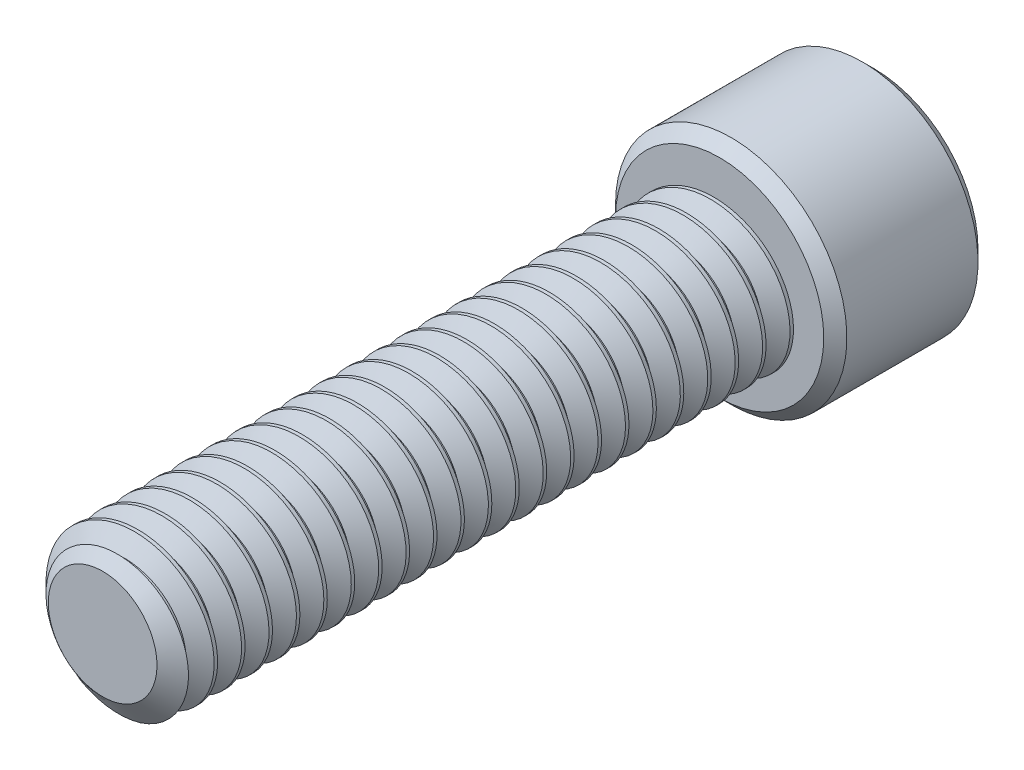
from build123d import *

# Parameters (mm, degrees)
SKETCH1_R          = 3.96875
EXTRUDE1_DEPTH     = 31.75
CUT_SWEEP1_PITCH   = 1.411111111
SKETCH6_R          = 5.953125
EXTRUDE2_DEPTH     = 7.9375
CUT_EXTRUDE1_DEPTH = 4.7625
CHAMFER1_SIZE      = 0.5953125


with BuildPart() as part:
    # Sketch1 → Extrude1 (new body)
    with BuildSketch(Plane.XY):
        Circle(SKETCH1_R)
    extrude(amount=-EXTRUDE1_DEPTH)

    # Cut-Sweep1: the profile of Sketch3 profile screwed along a right-hand helix of 23.5 turns, 6 arcs to a turn; built about Z, then put on its axis
    cut_sweep1_z = Axis((0, 0, 0), (0, 0, 1))
    cut_sweep1_corners = [(3.96905, 0, -1.234895427), (3.052206448, 0, -0.705555556), (3.052206448, 0, -0.529166667), (3.96905, 0, 0.000173205)]
    with BuildLine(mode=Mode.PRIVATE) as cut_sweep1_profile:
        Line(cut_sweep1_corners[0], cut_sweep1_corners[1])
        Line(cut_sweep1_corners[1], cut_sweep1_corners[2])
        Line(cut_sweep1_corners[2], cut_sweep1_corners[3])
        Line(cut_sweep1_corners[3], cut_sweep1_corners[0])
    cut_sweep1_cap = Face(cut_sweep1_profile.wire())
    cut_sweep1_turn_angles = [0, 30, 60, 90, 120, 150, 180, 210, 240, 270, 300, 330, 360]
    cut_sweep1_turn_weights = [1, 0.8660254037844387, 1, 0.8660254037844387, 1, 0.8660254037844387, 1, 0.8660254037844387, 1, 0.8660254037844387, 1, 0.8660254037844387, 1]
    cut_sweep1_turn_rails = [Edge.make_bspline([Vector(p[0], p[1], 0).rotate(cut_sweep1_z, cut_sweep1_turn_angles[k]) / cut_sweep1_turn_weights[k] + Vector(0, 0, p[2] + CUT_SWEEP1_PITCH * cut_sweep1_turn_angles[k] / 360) for k in range(13)], [0, 0, 0, 1, 1, 2, 2, 3, 3, 4, 4, 5, 5, 6, 6, 6], 2, cut_sweep1_turn_weights) for p in cut_sweep1_corners]
    cut_sweep1_turn_sides = [Face.make_surface_from_curves(cut_sweep1_turn_rails[p[0]], cut_sweep1_turn_rails[p[1]]) for p in [(0, 1), (1, 2), (2, 3), (3, 0)]]
    cut_sweep1_last_angles = [8280, 8310, 8340, 8370, 8400, 8430, 8460]
    cut_sweep1_last_weights = [1, 0.8660254037844387, 1, 0.8660254037844387, 1, 0.8660254037839783, 1]
    cut_sweep1_last_rails = [Edge.make_bspline([Vector(p[0], p[1], 0).rotate(cut_sweep1_z, cut_sweep1_last_angles[k]) / cut_sweep1_last_weights[k] + Vector(0, 0, p[2] + CUT_SWEEP1_PITCH * cut_sweep1_last_angles[k] / 360) for k in range(7)], [0, 0, 0, 1, 1, 2, 2, 3, 3, 3], 2, cut_sweep1_last_weights) for p in cut_sweep1_corners]
    cut_sweep1_last_sides = [Face.make_surface_from_curves(cut_sweep1_last_rails[p[0]], cut_sweep1_last_rails[p[1]]) for p in [(0, 1), (1, 2), (2, 3), (3, 0)]]
    cut_sweep1 = Plane(origin=(0, 0, 0), x_dir=(0, 1, 0), z_dir=(0, 0, -1)) * Solid(Shell([*[p.moved(Location((0, 0, CUT_SWEEP1_PITCH * i))) for i in range(23) for p in cut_sweep1_turn_sides], *cut_sweep1_last_sides, cut_sweep1_cap, cut_sweep1_cap.rotate(cut_sweep1_z, 8460).moved(Location((0, 0, CUT_SWEEP1_PITCH * 8460 / 360)))]))
    add(cut_sweep1, mode=Mode.SUBTRACT)

    # Sketch4 → Cut-Revolve1 (revolve, cut)
    with BuildSketch(Plane(origin=(0, 0, 0), x_dir=(0, 0, -1), z_dir=(1, 0, 0)), mode=Mode.PRIVATE) as cut_revolve1_sk:
        Polygon((0.819623419, 3.96875), (0, 2.798206448), (0, 3.96875), align=None)
    revolve(cut_revolve1_sk.sketch.rotate(Axis((0, 0, 0), (0, 0, -1)), 224.846133378), axis=Axis((0, 0, 0), (0, 0, -1)), mode=Mode.SUBTRACT)

    # Sketch6 → Extrude2 (add)
    with BuildSketch(Plane(origin=(0, 0, -31.75), x_dir=(-1, 0, 0), z_dir=(0, 0, -1))):
        Circle(SKETCH6_R)
    extrude(amount=EXTRUDE2_DEPTH)

    # Sketch7 → Cut-Extrude1 (cut)
    with BuildSketch(Plane(origin=(0, 0, -39.6875), x_dir=(-1, 0, 0), z_dir=(0, 0, -1))):
        Polygon((0, 3.666174209), (-3.175, 1.833087105), (-3.175, -1.833087105), (0, -3.666174209), (3.175, -1.833087105), (3.175, 1.833087105), align=None)
    extrude(amount=-CUT_EXTRUDE1_DEPTH, mode=Mode.SUBTRACT)

    # Cut-Extrude2 cone 1 section (through the dimple's axis) → Cut-Extrude2 (revolve, cut)
    with BuildSketch(Plane(origin=(0, 0, -39.6875), x_dir=(0, 1, 0), z_dir=(1, 0, 0))):
        Polygon((0, 0), (3.666174209, 0), (0, 3.666174209), align=None)
    revolve(axis=Axis((0, 0, -39.6875), (0, 0, 1)), mode=Mode.SUBTRACT)

    # Chamfer1
    chamfer1_edges = [part.edges().sort_by_distance(p)[0] for p in [
        (5.953125, 0, -31.75),
        (5.953125, 0, -39.6875),
    ]]
    chamfer(chamfer1_edges, length=CHAMFER1_SIZE)


solid = part.part
